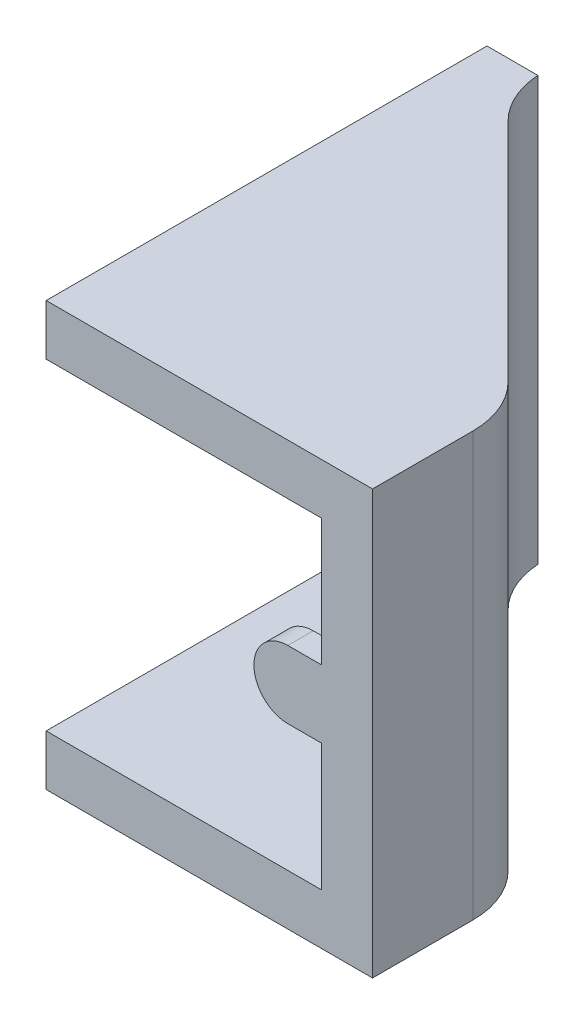
from build123d import *

# Parameters (mm, degrees)
SKETCH_1_W          = 10
SKETCH_1_H          = 15
EXTRUDE_1_DEPTH     = 3
SKETCH_2_W          = 3
SKETCH_2_H          = 25
EXTRUDE_2_DEPTH     = 6
EXTRUDE_3_DEPTH     = 25
EXTRUDE_4_DEPTH     = 3
EXTRUDE_5_DEPTH     = 3
FILLET_1_R          = 5
SKETCH_6_W          = 10
SKETCH_6_H          = 15
CUT_EXTRUDE_1_DEPTH = 3
FILLET_2_R          = 5
SKETCH_7_W          = 1.5
SKETCH_7_H          = 4
EXTRUDE_6_DEPTH     = 4
FILLET_3_R          = 2


# Some blends are built 0.0001 mm under size
with BuildPart() as part:
    # 草图1 → 凸台-拉伸1 (new body)
    with BuildSketch(Plane.XY):
        with Locations((5, -7.5)):
            Rectangle(SKETCH_1_W, SKETCH_1_H)
    extrude(amount=EXTRUDE_1_DEPTH)

    # 草图2 → 凸台-拉伸2 (add)
    with BuildSketch(Plane.XY.offset(3)):
        with Locations((8.5, -7.5)):
            Rectangle(SKETCH_2_W, SKETCH_2_H)
    extrude(amount=EXTRUDE_2_DEPTH)

    # 草图3 → 凸台-拉伸3 (add)
    with BuildSketch(Plane(origin=(0, -20, 0), x_dir=(-1, 0, 0), z_dir=(0, -1, 0))):
        Polygon((-10, -9), (-23.263455967, -22.263455967), (-23.263455967, -29.02081528), (-26.263455967, -29.02081528), (-26.263455967, -21.02081528), (-10, -4.757359313), align=None)
    extrude(amount=-EXTRUDE_3_DEPTH)

    # 草图4 → 凸台-拉伸4 (add)
    with BuildSketch(Plane(origin=(0, -20, 0), x_dir=(-1, 0, 0), z_dir=(0, -1, 0))):
        Polygon((-7, -9), (-10, -9), (-23.263455967, -22.263455967), (-23.263455967, -29.02081528), (-7, -29.02081528), align=None)
    extrude(amount=-EXTRUDE_4_DEPTH)

    # 草图5 → 凸台-拉伸5 (add)
    with BuildSketch(Plane(origin=(0, 5, 0), x_dir=(1, 0, 0), z_dir=(0, 1, 0))):
        Polygon((7, -9), (10, -9), (23.263455967, -22.263455967), (23.263455967, -29.02081528), (7, -29.02081528), align=None)
    extrude(amount=-EXTRUDE_5_DEPTH)

    # 圆角1
    fillet_1_edges = [part.edges().sort_by_distance(p)[0] for p in [
        (26.263455967, -7.5, 21.02081528),
    ]]
    fillet(fillet_1_edges, radius=FILLET_1_R)

    # 草图6 → 切除-拉伸1 (cut)
    with BuildSketch(Plane(origin=(0, 0, 0), x_dir=(-1, 0, 0), z_dir=(0, 0, -1))):
        with Locations((-5, -7.5)):
            Rectangle(SKETCH_6_W, SKETCH_6_H)
    extrude(amount=-CUT_EXTRUDE_1_DEPTH, mode=Mode.SUBTRACT)

    # 圆角2
    # the kernel refuses this fillet: 5 mm, written as the material it adds along each edge
    with BuildSketch(Plane(origin=(10, -20, 4.757359313), x_dir=(0, 0, -1), z_dir=(0, 1, 0))) as fillet_2_piece_1:
        with BuildLine():
            CenterArc((2.08159154, -4.989476271), FILLET_2_R, 93.718036518, 41.281963482)
            Line((-1.453942365, -1.453942365), (-1.524653044, -1.383231687))
            Line((-1.524653044, -1.383231687), (-0.070710678, 0.070710678))
            Line((-0.070710678, 0.070710678), (0, 0.1))
            ThreePointArc((0, 0.1), (0.878679656, 0.1), (1.750874668, 0.099789525))
            Line((1.750874668, 0.099789525), (1.757359313, 0))
        make_face()
    extrude(amount=25)

    # 草图7 → 凸台-拉伸6 (add)
    with BuildSketch(Plane.ZY.offset(-23.263455967)):
        with Locations((28.27081528, -7.5)):
            Rectangle(SKETCH_7_W, SKETCH_7_H)
    extrude(amount=EXTRUDE_6_DEPTH)

    # 圆角3
    fillet_3_edges = [part.edges().sort_by_distance(p)[0] for p in [
        (19.263455967, -9.5, 28.27081528),
        (19.263455967, -5.5, 28.27081528),
    ]]
    fillet(fillet_3_edges, radius=FILLET_3_R - 0.0001)  # a hair under: the kernel refuses the full size


solid = part.part
